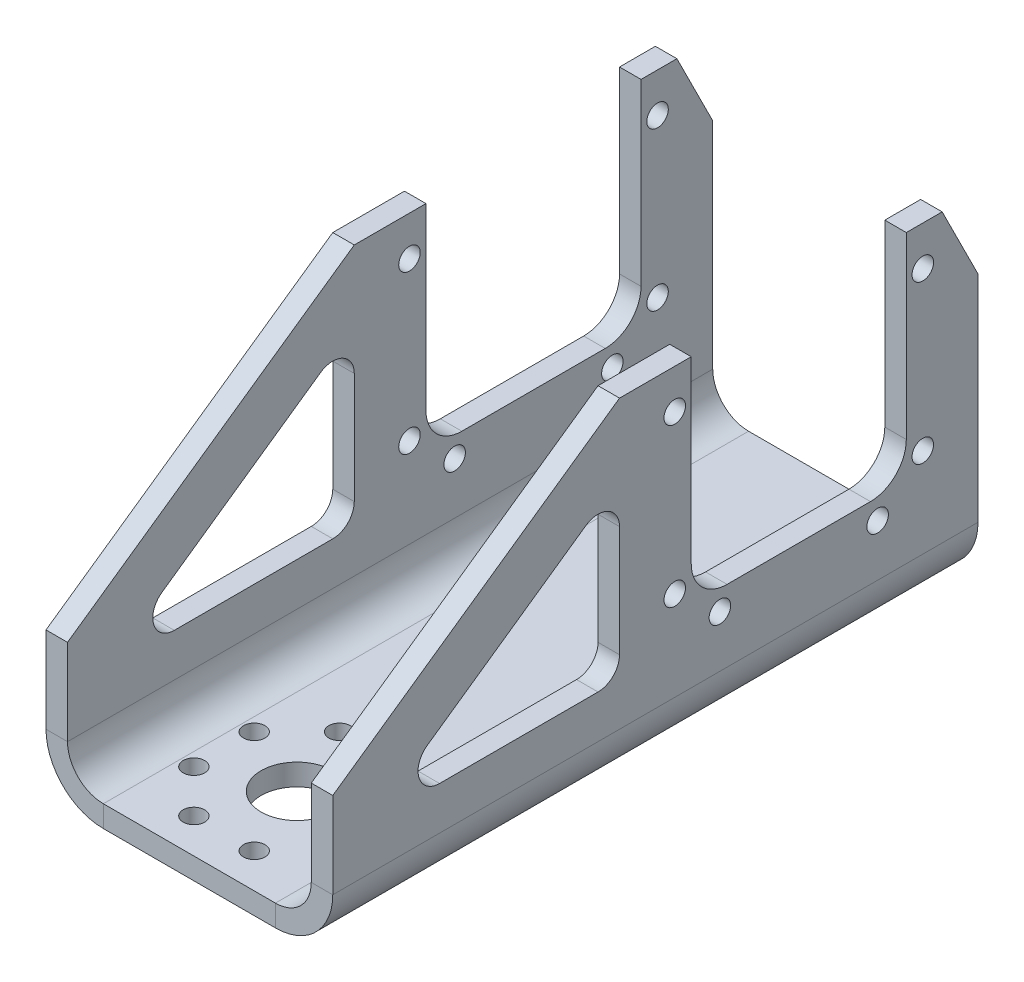
from build123d import *

# Parameters (mm, degrees)
BASIS_BLECH1_DEPTH                   = 45
SKIZZE3_R                            = 5
SCHNITT_LINEAR_AUSTRAGEN2_DEPTH      = 67.708320321
SCHNITT_LINEAR_AUSTRAGEN1_DEPTH      = 67.708320321
SCHNITT_LINEAR_AUSTRAGEN1_DEPTH_BACK = 67.708320321
F_3_0_3_DURCHMESSER_BOHRUNG1_D       = 3
F_3_0_3_DURCHMESSER_BOHRUNG2_D       = 3


# Sheet-metal steps are written as plain solids
with BuildPart() as part:
    # Skizze1 → Basis-Blech1 (new, symmetric)
    with BuildSketch(Plane.XY):
        with BuildLine():
            Line((-17, 45), (-17, 5))
            ThreePointArc((-17, 5), (-15.535533906, 1.464466094), (-12, 0))
            Line((-12, 0), (12, 0))
            ThreePointArc((12, 0), (15.535533906, 1.464466094), (17, 5))
            Line((17, 5), (17, 45))
            Line((17, 45), (20, 45))
            Line((20, 45), (20, 5))
            ThreePointArc((20, 5), (17.656854249, -0.656854249), (12, -3))
            Line((12, -3), (-12, -3))
            ThreePointArc((-12, -3), (-17.656854249, -0.656854249), (-20, 5))
            Line((-20, 5), (-20, 45))
            Line((-20, 45), (-17, 45))
        make_face()
    extrude(amount=BASIS_BLECH1_DEPTH, both=True)

    # Skizze3 → Schnitt-Linear austragen2 (cut, through all)
    with BuildSketch(Plane(origin=(0, 0, 0), x_dir=(1, 0, 0), z_dir=(0, 1, 0))):
        with Locations(Location((0, -30, 0), (0, 0, 270))):
            Circle(SKIZZE3_R)
    extrude(amount=-SCHNITT_LINEAR_AUSTRAGEN2_DEPTH, mode=Mode.SUBTRACT)

    # Skizze2 → Schnitt-Linear austragen1 (cut, two sides: drawn at the far end of the back side and taken through both)
    with BuildSketch(Plane(origin=(0, 0, 0), x_dir=(0, 0, -1), z_dir=(1, 0, 0)).offset(-SCHNITT_LINEAR_AUSTRAGEN1_DEPTH_BACK)):
        with BuildLine():
            Line((35, 45), (5, 45))
            Line((5, 45), (5, 20))
            ThreePointArc((5, 20), (6.464466094, 16.464466094), (10, 15))
            Line((10, 15), (30, 15))
            ThreePointArc((30, 15), (33.535533906, 16.464466094), (35, 20))
            Line((35, 20), (35, 45))
        make_face()
        Polygon((-45, 45), (-5, 45), (-45, 17), align=None)
        Polygon((45, 45), (40, 45), (45, 35), align=None)
        with BuildLine():
            Line((-5, 29.472788823), (-5, 14))
            ThreePointArc((-5, 14), (-5.878679656, 11.878679656), (-8, 11))
            Line((-8, 11), (-30.103984032, 11))
            ThreePointArc((-30.103984032, 11), (-32.965197698, 13.098081845), (-31.824371066, 16.457695762))
            Line((-31.824371066, 16.457695762), (-9.720387033, 31.930484584))
            ThreePointArc((-9.720387033, 31.930484584), (-6.614568858, 32.133724852), (-5, 29.472788823))
        make_face()
    extrude(amount=SCHNITT_LINEAR_AUSTRAGEN1_DEPTH + SCHNITT_LINEAR_AUSTRAGEN1_DEPTH_BACK, mode=Mode.SUBTRACT)

    # Ø3.0 (3) Durchmesser Bohrung1 (through all)
    with Locations(Plane.ZY.offset(20)):
        with Locations((-37.3, 39.5), (-37.3, 17.5), (-31, 12.2), (-9, 12.2), (-2.7, 17.5), (-2.7, 39.5)):
            Hole(F_3_0_3_DURCHMESSER_BOHRUNG1_D / 2)

    # Ø3.0 (3) Durchmesser Bohrung2 (through all)
    with Locations(Plane(origin=(0, 0, 0), x_dir=(1, 0, 0), z_dir=(0, 1, 0))):
        with Locations((10.162674858, -25.790482244), (4.209517756, -19.837325142), (-4.209517756, -19.837325142), (-10.162674858, -25.790482244), (-10.162674858, -34.209517756), (-4.209517756, -40.162674858), (4.209517756, -40.162674858), (10.162674858, -34.209517756)):
            Hole(F_3_0_3_DURCHMESSER_BOHRUNG2_D / 2)


solid = part.part
